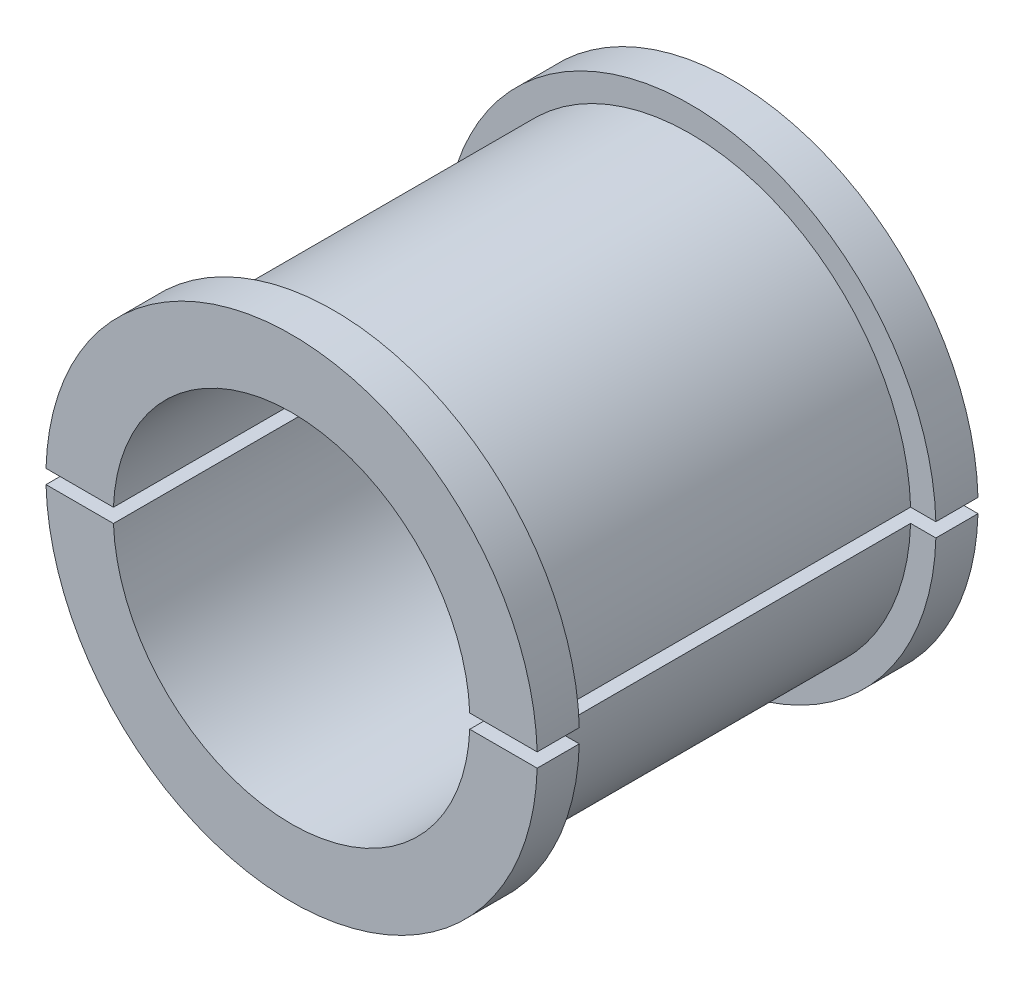
from build123d import *

# Parameters (mm, degrees)
CUT_EXTRUDE1_DEPTH      = 30.308531181
CUT_EXTRUDE1_DEPTH_BACK = 30.308531181
SKETCH2_W               = 42.06954519
SKETCH2_H               = 1


with BuildPart() as part:
    # Sketch1 → Revolve1 (revolve)
    with BuildSketch(Plane(origin=(0, 0, 0), x_dir=(0, 0, -1), z_dir=(1, 0, 0))):
        Polygon((-15.7, 12.7), (-15.7, 17.5), (-12.7, 17.5), (-12.7, 15.7), (12.7, 15.7), (12.7, 17.5), (15.7, 17.5), (15.7, 12.7), align=None)
    revolve(axis=Axis((0, 0, 67.856305953), (0, 0, -1)))

    # Sketch2 → Cut-Extrude1 (cut, two sides: drawn at the far end of the back side and taken through both)
    with BuildSketch(Plane.XY.offset(-CUT_EXTRUDE1_DEPTH_BACK)):
        Rectangle(SKETCH2_W, SKETCH2_H)
    extrude(amount=CUT_EXTRUDE1_DEPTH + CUT_EXTRUDE1_DEPTH_BACK, mode=Mode.SUBTRACT)


with BuildPart() as cut_extrude1_piece_1:
    # of the separate pieces the step leaves, piece 1, a body of its own (cut_extrude1_pieces)
    add(part.part.solids().sort_by_distance((-12.690153663, 0.5, 15.7))[0])


with BuildPart() as cut_extrude1_piece_2:
    # of the separate pieces the step leaves, piece 2, a body of its own (cut_extrude1_pieces)
    add(part.part.solids().sort_by_distance((17.492855685, -0.5, 15.7))[0])


solid = Compound([cut_extrude1_piece_1.part, cut_extrude1_piece_2.part])
